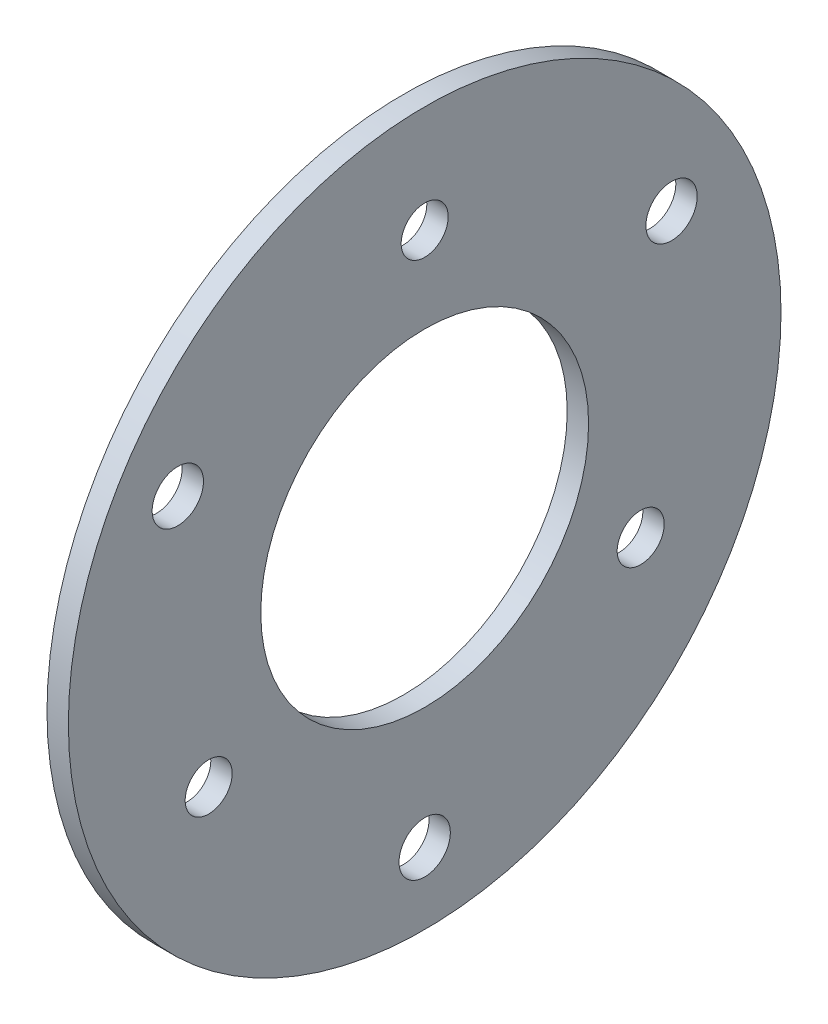
from build123d import *

# Parameters (mm, degrees)
SZKIC1_R                    = 50
SZKIC1_R_2                  = 23
SZKIC1_R_3                  = 3.3
SZKIC1_R_4                  = 3.6
DODANIE_WYCI_GNI_CIE1_DEPTH = 3


with BuildPart() as part:
    # Szkic1 → Dodanie-wyciągnięcie1 (new body)
    with BuildSketch(Plane(origin=(0, 0, 0), x_dir=(0, 0, -1), z_dir=(1, 0, 0))):
        Circle(SZKIC1_R)
        Circle(SZKIC1_R_2, mode=Mode.SUBTRACT)
        with Locations((0, 35)):
            Circle(SZKIC1_R_3, mode=Mode.SUBTRACT)
        with Locations((30.310889132, -17.5)):
            Circle(SZKIC1_R_3, mode=Mode.SUBTRACT)
        with Locations((-30.310889132, -17.5)):
            Circle(SZKIC1_R_3, mode=Mode.SUBTRACT)
        with Locations((0, -40)):
            Circle(SZKIC1_R_4, mode=Mode.SUBTRACT)
        with Locations((-34.641016151, 20)):
            Circle(SZKIC1_R_4, mode=Mode.SUBTRACT)
        with Locations((34.641016151, 20)):
            Circle(SZKIC1_R_4, mode=Mode.SUBTRACT)
    extrude(amount=DODANIE_WYCI_GNI_CIE1_DEPTH)


solid = part.part
